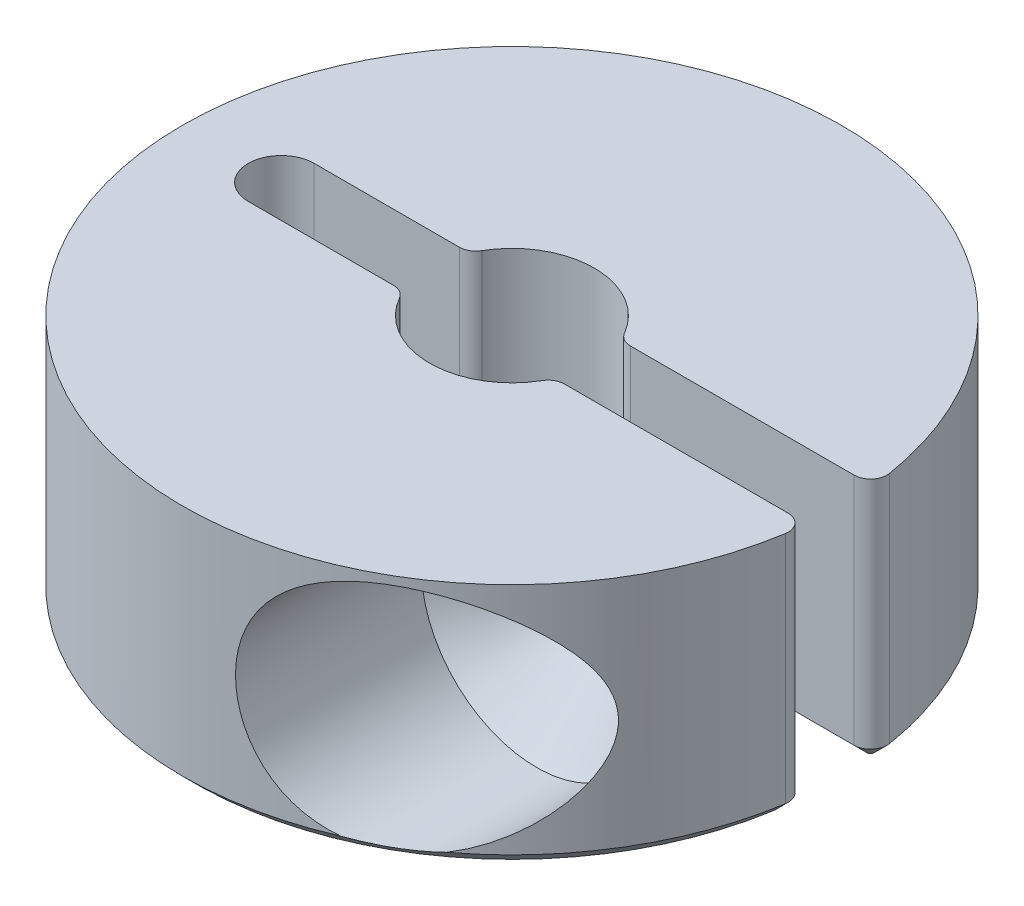
from build123d import *

# Parameters (mm, degrees)
SKETCH1_R               = 10
SKETCH1_R_2             = 2.5
BOSS_EXTRUDE1_DEPTH     = 3.75
CUT_EXTRUDE1_DEPTH      = 17.007810594
CUT_EXTRUDE2_DEPTH      = 16.331748106
CUT_EXTRUDE2_DEPTH_BACK = 16.331748106
SKETCH3_R               = 1.25
SKETCH4_R               = 1.75
CUT_EXTRUDE3_DEPTH      = 16.331748268
CUT_EXTRUDE4_START      = 6
SKETCH5_R               = 3.5
CUT_EXTRUDE4_DEPTH      = 8
CHAMFER1_SIZE           = 2.5
FILLET1_R               = 0.5
CHAMFER2_SIZE           = 0.4


with BuildPart() as part:
    # Sketch1 → Boss-Extrude1 (new, symmetric)
    with BuildSketch(Plane(origin=(0, 0, 0), x_dir=(1, 0, 0), z_dir=(0, 1, 0))):
        with Locations(Location((0, 0, 0), (0, 0, 270))):
            Circle(SKETCH1_R)
        with Locations(Location((0, 0, 0), (0, 0, 270))):
            Circle(SKETCH1_R_2, mode=Mode.SUBTRACT)
    extrude(amount=BOSS_EXTRUDE1_DEPTH, both=True)

    # Sketch2 → Cut-Extrude1 (cut, through all)
    with BuildSketch(Plane(origin=(0, 3.75, 0), x_dir=(1, 0, 0), z_dir=(0, 1, 0))):
        with BuildLine():
            Line((10, -1), (-7, -1))
            ThreePointArc((-7, -1), (-8, 0), (-7, 1))
            Line((-7, 1), (10, 1))
            ThreePointArc((10, 1), (11, 0), (10, -1))
        make_face()
    extrude(amount=-CUT_EXTRUDE1_DEPTH, mode=Mode.SUBTRACT)

    # Sketch3 → Cut-Extrude2 (cut, two sides: drawn at the far end of the back side and taken through both)
    with BuildSketch(Plane.XY.offset(-1).offset(-CUT_EXTRUDE2_DEPTH_BACK)):
        with Locations((5, 0)):
            Circle(SKETCH3_R)
    extrude(amount=CUT_EXTRUDE2_DEPTH + CUT_EXTRUDE2_DEPTH_BACK, mode=Mode.SUBTRACT)

    # Sketch4 → Cut-Extrude3 (cut, through all)
    with BuildSketch(Plane.XY.offset(-1)):
        with Locations(Location((5, 0, 0), (0, 0, 180))):
            Circle(SKETCH4_R)
    extrude(amount=CUT_EXTRUDE3_DEPTH, mode=Mode.SUBTRACT)

    # Sketch5 → Cut-Extrude4 (cut)
    with BuildSketch(Plane.XY.offset(-1).offset(CUT_EXTRUDE4_START)):
        with Locations(Location((5, 0, 0), (0, 0, 180))):
            Circle(SKETCH5_R)
    extrude(amount=CUT_EXTRUDE4_DEPTH, mode=Mode.SUBTRACT)

    # Chamfer1
    # the kernel refuses this chamfer: 2.5 mm, written as the material it takes off along each edge
    with BuildSketch(Plane(origin=(5, 0, 5), x_dir=(-1, 0, 0), z_dir=(0, -1, 0))) as chamfer1_piece_1_section:
        Polygon((1.75, CHAMFER1_SIZE), (1.75 + CHAMFER1_SIZE, 0), (1.75, 0), align=None)
    chamfer1_piece_1 = revolve(axis=Axis((5, 0, 5), (0, 0, -1)), mode=Mode.PRIVATE)
    chamfer1_piece_1 = chamfer1_piece_1 & Plane(origin=(5, 0, 3.399981632), x_dir=(-1, 0, 0), z_dir=(0, 0, -1)) * Cylinder(3.5, 17, mode=Mode.PRIVATE)
    add(chamfer1_piece_1, mode=Mode.SUBTRACT)

    # Fillet1
    fillet1_edges = [part.edges().sort_by_distance(p)[0] for p in [
        (-2.291287847, 0, -1),
        (2.291287847, 0, -1),
        (2.291287847, 0, 1),
        (-2.291287847, 0, 1),
        (9.949874371, 0, 1),
        (9.949874371, 0, -1),
    ]]
    fillet(fillet1_edges, radius=FILLET1_R)

    # Chamfer2
    # the kernel refuses this chamfer: 0.4 mm, written as the material it takes off along each edge
    with BuildSketch(Plane(origin=(9.38083152, -3.75, 1.5), x_dir=(0.9874559494365127, 0, 0.15789473684209784), z_dir=(-0.15789473684209784, 0, 0.9874559494365127))) as chamfer2_piece_1:
        Polygon((0.5, CHAMFER2_SIZE), (0.5 - CHAMFER2_SIZE, 0), (0.5, 0), align=None)
    revolve(axis=Axis((9.38083152, -3.75, 1.5), (0, 1, 0)), revolution_arc=99.084720287, mode=Mode.SUBTRACT)
    with BuildSketch(Plane(origin=(0, -3.75, 0), x_dir=(0.9874559494365116, 0, -0.15789473684210514), z_dir=(0.15789473684210514, 0, 0.9874559494365116))) as chamfer2_piece_2:
        Polygon((10, CHAMFER2_SIZE), (10 - CHAMFER2_SIZE, 0), (10, 0), align=None)
    revolve(axis=Axis((0, -3.75, 0), (0, 1, 0)), revolution_arc=341.830559425, mode=Mode.SUBTRACT)
    with BuildSketch(Plane(origin=(9.38083152, -3.75, 1), x_dir=(0, -0.027495876610586285, 0.9996219169112968), z_dir=(-1, 0, 0)), Plane(origin=(2.598076211, -3.75, -1), x_dir=(0, -0.027495876610586285, -0.9996219169112968), z_dir=(1, 0, 0))) as chamfer2_piece_3:
        Polygon((CHAMFER2_SIZE * 0.999621916911, CHAMFER2_SIZE * 0.0274958766106), (-CHAMFER2_SIZE * 0.0274958766106, CHAMFER2_SIZE * 0.999621916911), (0, 0), align=None)
    extrude(amount=6.782755308, mode=Mode.SUBTRACT)
    with BuildSketch(Plane(origin=(9.38083152, -3.75, -1.5), x_dir=(0.9874559494365118, 0, -0.1578947368421039), z_dir=(-0.1578947368421039, 0, -0.9874559494365118))) as chamfer2_piece_4:
        Polygon((0.5, -CHAMFER2_SIZE), (0.5 - CHAMFER2_SIZE, 0), (0.5, 0), align=None)
    revolve(axis=Axis((9.38083152, -3.75, -1.5), (0, -1, 0)), revolution_arc=99.084720287, mode=Mode.SUBTRACT)
    with BuildSketch(Plane(origin=(2.598076211, -3.75, 1.5), x_dir=(-0.8660254037844399, 0, -0.49999999999999767), z_dir=(-0.49999999999999767, 0, 0.8660254037844399))) as chamfer2_piece_5:
        Polygon((0.5 - CHAMFER2_SIZE, 0), (0.5, -CHAMFER2_SIZE), (0.5, 0), align=None)
    revolve(axis=Axis((2.598076211, -3.75, 1.5), (0, -1, 0)), revolution_arc=60, mode=Mode.SUBTRACT)
    with BuildSketch(Plane(origin=(0, -3.75, 0), x_dir=(-0.8660254037844383, 0, 0.5000000000000007), z_dir=(-0.5000000000000007, 0, -0.8660254037844383))) as chamfer2_piece_6:
        Polygon((2.5 + CHAMFER2_SIZE, 0), (2.5, CHAMFER2_SIZE), (2.5, 0), align=None)
    revolve(axis=Axis((0, -3.75, 0), (0, 1, 0)), revolution_arc=120, mode=Mode.SUBTRACT)
    with BuildSketch(Plane(origin=(2.598076211, -3.75, -1.5), x_dir=(-0.866025403784439, 0, 0.49999999999999944), z_dir=(-0.49999999999999944, 0, -0.866025403784439))) as chamfer2_piece_7:
        Polygon((0.5 - CHAMFER2_SIZE, 0), (0.5, CHAMFER2_SIZE), (0.5, 0), align=None)
    revolve(axis=Axis((2.598076211, -3.75, -1.5), (0, 1, 0)), revolution_arc=60, mode=Mode.SUBTRACT)
    with BuildSketch(Plane(origin=(-2.598076211, -3.75, 1.5), x_dir=(0, 0, -1), z_dir=(-1, 0, 0))) as chamfer2_piece_8:
        Polygon((0.5 - CHAMFER2_SIZE, 0), (0.5, -CHAMFER2_SIZE), (0.5, 0), align=None)
    revolve(axis=Axis((-2.598076211, -3.75, 1.5), (0, -1, 0)), revolution_arc=60, mode=Mode.SUBTRACT)
    with BuildSketch(Plane(origin=(0, -3.75, 0), x_dir=(0.8660254037844389, 0, -0.49999999999999967), z_dir=(0.49999999999999967, 0, 0.8660254037844389))) as chamfer2_piece_9:
        Polygon((2.5 + CHAMFER2_SIZE, 0), (2.5, CHAMFER2_SIZE), (2.5, 0), align=None)
    revolve(axis=Axis((0, -3.75, 0), (0, 1, 0)), revolution_arc=120, mode=Mode.SUBTRACT)
    with BuildSketch(Plane(origin=(-2.598076211, -3.75, 1), x_dir=(0, -0.027495876610586285, 0.9996219169112968), z_dir=(-1, 0, 0)), Plane(origin=(-7, -3.75, -1), x_dir=(0, -0.027495876610586275, -0.9996219169112966), z_dir=(1, 0, 0))) as chamfer2_piece_10:
        Polygon((CHAMFER2_SIZE * 0.999621916911, CHAMFER2_SIZE * 0.0274958766106), (-CHAMFER2_SIZE * 0.0274958766106, CHAMFER2_SIZE * 0.999621916911), (0, 0), align=None)
    extrude(amount=4.401923789, mode=Mode.SUBTRACT)
    with BuildSketch(Plane(origin=(-2.598076211, -3.75, -1.5), x_dir=(0.8660254037844403, 0, 0.4999999999999974), z_dir=(0.4999999999999974, 0, -0.8660254037844403))) as chamfer2_piece_11:
        Polygon((0.5 - CHAMFER2_SIZE, 0), (0.5, -CHAMFER2_SIZE), (0.5, 0), align=None)
    revolve(axis=Axis((-2.598076211, -3.75, -1.5), (0, -1, 0)), revolution_arc=60, mode=Mode.SUBTRACT)
    with BuildSketch(Plane(origin=(-7, -3.75, 0), x_dir=(0, 0, -1), z_dir=(1, 0, 0))) as chamfer2_piece_12:
        Polygon((1 + CHAMFER2_SIZE, 0), (1, CHAMFER2_SIZE), (1, 0), align=None)
    revolve(axis=Axis((-7, -3.75, 0), (0, 1, 0)), revolution_arc=180, mode=Mode.SUBTRACT)


solid = part.part
